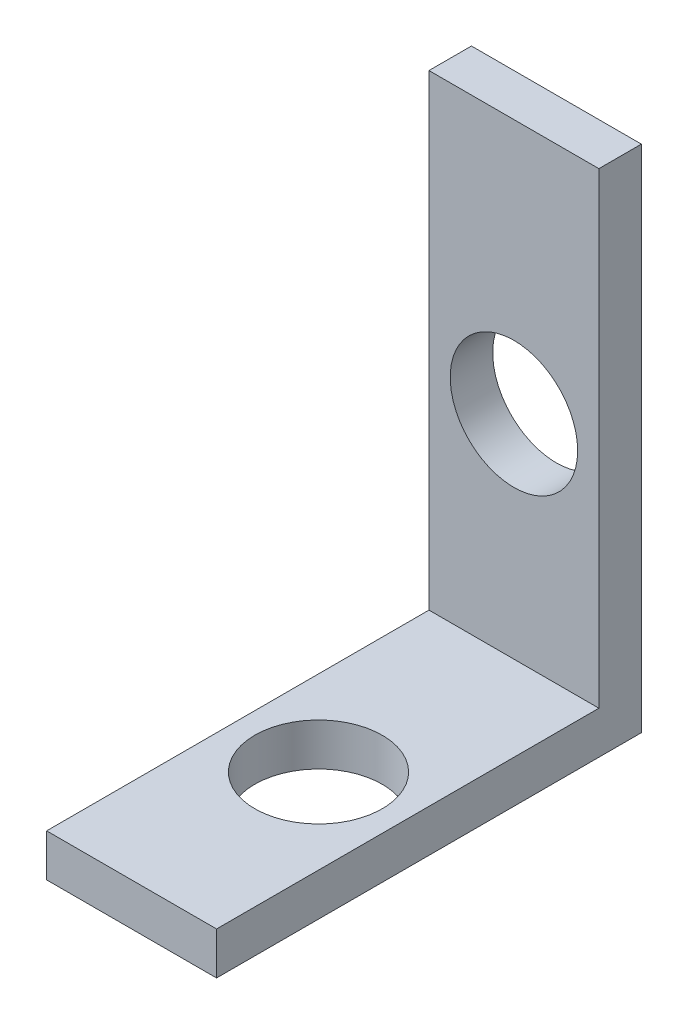
from build123d import *

# Parameters (mm, degrees)
SKETCH1_W           = 4
SKETCH1_H           = 1
BOSS_EXTRUDE1_DEPTH = 10
SKETCH11_W          = 4
SKETCH11_H          = 1
BOSS_EXTRUDE2_DEPTH = 11
SKETCH12_R          = 1.5
CUT_EXTRUDE1_DEPTH  = 10
SKETCH13_R          = 1.5
CUT_EXTRUDE2_DEPTH  = 10


with BuildPart() as part:
    # Sketch1 → Boss-Extrude1 (new body)
    with BuildSketch(Plane.XY):
        Rectangle(SKETCH1_W, SKETCH1_H)
    extrude(amount=BOSS_EXTRUDE1_DEPTH)

    # Sketch11 → Boss-Extrude2 (add)
    with BuildSketch(Plane(origin=(0, 0.5, 0), x_dir=(1, 0, 0), z_dir=(0, 1, 0))):
        with Locations((0, -0.5)):
            Rectangle(SKETCH11_W, SKETCH11_H)
    extrude(amount=BOSS_EXTRUDE2_DEPTH)

    # Sketch12 → Cut-Extrude1 (cut)
    with BuildSketch(Plane(origin=(0, 0.5, 0), x_dir=(1, 0, 0), z_dir=(0, 1, 0))):
        with Locations(Location((0, -5.6, 0), (0, 0, 180))):
            Circle(SKETCH12_R)
    extrude(amount=-CUT_EXTRUDE1_DEPTH, mode=Mode.SUBTRACT)

    # Sketch13 → Cut-Extrude2 (cut)
    with BuildSketch(Plane.XY.offset(1)):
        with Locations((0, 5.5)):
            Circle(SKETCH13_R)
    extrude(amount=-CUT_EXTRUDE2_DEPTH, mode=Mode.SUBTRACT)


solid = part.part
